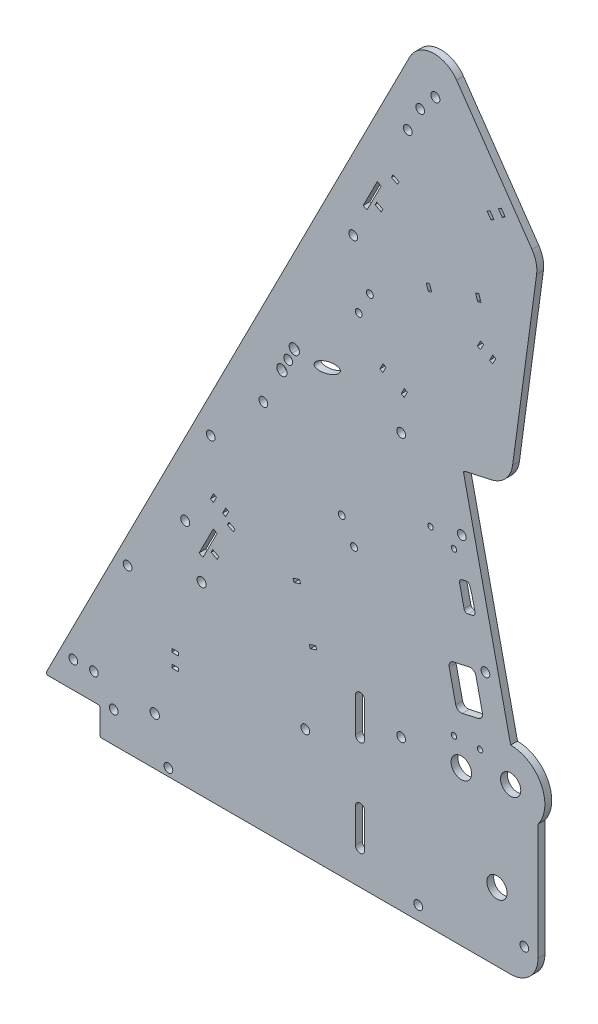
from build123d import *

# Parameters (mm, degrees)
BOSS_EXTRUDE1_DEPTH     = 3.175
SKETCH2_R               = 2.0955
SKETCH2_R_2             = 2.032
SKETCH2_R_3             = 4.699
CUT_EXTRUDE1_DEPTH      = 421.976111717
SKETCH7_R               = 2.159
CUT_EXTRUDE2_DEPTH      = 421.976111717
CUT_EXTRUDE3_REACH      = 422.976
SKETCH10_R              = 2.032
FILLET1_R               = 12.7
FILLET2_R               = 0.79375
SKETCH12_R              = 2.032
CUT_EXTRUDE5_DEPTH      = 411.989226146
CUT_EXTRUDE6_DEPTH      = 411.989226146
CUT_EXTRUDE6_DEPTH_BACK = 411.989226146
SKETCH13_R              = 1.27
SKETCH14_R              = 2.032
SKETCH14_R_2            = 1.6
SKETCH14_RX             = 6.35
SKETCH14_RY             = 2.38125
SKETCH14_W              = 3.175
SKETCH14_H              = 1.5875
CUT_EXTRUDE7_DEPTH      = 411.989226146
SKETCH15_R              = 2.032
CUT_EXTRUDE8_DEPTH      = 411.989226285
FILLET3_R               = 2.54
SKETCH16_R              = 4.7625
CUT_EXTRUDE9_DEPTH      = 411.989226285


with BuildPart() as part:
    # Sketch1 → Boss-Extrude1 (new body)
    with BuildSketch(Plane.XY):
        with BuildLine():
            Line((228.6, -12.7), (228.6, 53.975))
            ThreePointArc((228.6, 53.975), (230.099031657, 70.599515829), (215.9, 79.375))
            Line((215.9, 79.375), (193.909735224, 178.566674323))
            Line((193.909735224, 178.566674323), (215.607913982, 183.377044743))
            Line((215.607913982, 183.377044743), (228.6, 279.4))
            Line((228.6, 279.4), (178.754725958, 351.413083686))
            Line((178.754725958, 351.413083686), (0, 0))
            Line((0, 0), (25.4, 0))
            Line((25.4, 0), (25.4, -12.7))
            Line((25.4, -12.7), (228.6, -12.7))
        make_face()
    extrude(amount=BOSS_EXTRUDE1_DEPTH)

    # Sketch2 → Cut-Extrude1 (cut, through all)
    with BuildSketch(Plane.XY.offset(3.175)):
        with Locations((64.943150167, 94.057839899)):
            Circle(SKETCH2_R)
        with Locations((180.975, 322.164313376)):
            Circle(SKETCH2_R)
        with Locations((72.544547852, 73.173171402)):
            Circle(SKETCH2_R)
        with Locations((193.207821773, 152.394364194)):
            Circle(SKETCH2_R_2)
        with Locations((215.9, 63.5)):
            Circle(SKETCH2_R_3)
        with Locations((173.0375, -6.35)):
            Circle(SKETCH2_R_2)
        with Locations((204.202954161, 102.798527032)):
            Circle(SKETCH2_R_2)
        with Locations((209.55, 19.05)):
            Circle(SKETCH2_R_3)
        with Locations((165.1, 179.3875)):
            Circle(SKETCH2_R_2)
    extrude(amount=-CUT_EXTRUDE1_DEPTH, mode=Mode.SUBTRACT)

    # Sketch7 → Cut-Extrude2 (cut, through all)
    with BuildSketch(Plane.XY.offset(3.175)):
        with Locations((50.8, 9.525)):
            Circle(SKETCH7_R)
        with BuildLine():
            Line((143.891, 3.175), (143.891, 19.05))
            ThreePointArc((143.891, 19.05), (146.05, 21.209), (148.209, 19.05))
            Line((148.209, 19.05), (148.209, 3.175))
            ThreePointArc((148.209, 3.175), (146.05, 1.016), (143.891, 3.175))
        make_face()
        with BuildLine():
            Line((143.891, 47.625), (143.891, 63.5))
            ThreePointArc((143.891, 63.5), (146.05, 65.659), (148.209, 63.5))
            Line((148.209, 63.5), (148.209, 47.625))
            ThreePointArc((148.209, 47.625), (146.05, 45.466), (143.891, 47.625))
        make_face()
    extrude(amount=-CUT_EXTRUDE2_DEPTH, mode=Mode.SUBTRACT)

    # Sketch10 → Cut-Extrude3 (cut, up to next)
    with BuildSketch(Plane.XY.offset(3.175), mode=Mode.PRIVATE) as cut_extrude3_sk1:
        with Locations((165.1, 57.15)):
            Circle(SKETCH10_R)
    cut_extrude3_tool1 = extrude(cut_extrude3_sk1.sketch, amount=-CUT_EXTRUDE3_REACH, mode=Mode.PRIVATE) & part.part
    # Sketch10 → Cut-Extrude3 (cut, up to next)
    with BuildSketch(Plane.XY.offset(3.175), mode=Mode.PRIVATE) as cut_extrude3_sk2:
        with Locations((120.65, 38.1)):
            Circle(SKETCH10_R)
    cut_extrude3_tool2 = extrude(cut_extrude3_sk2.sketch, amount=-CUT_EXTRUDE3_REACH, mode=Mode.PRIVATE) & part.part
    # Sketch10 → Cut-Extrude3 (cut, up to next)
    with BuildSketch(Plane.XY.offset(3.175), mode=Mode.PRIVATE) as cut_extrude3_sk3:
        with Locations((13.046467246, 12.334704411)):
            Circle(SKETCH10_R)
    cut_extrude3_tool3 = extrude(cut_extrude3_sk3.sketch, amount=-CUT_EXTRUDE3_REACH, mode=Mode.PRIVATE) & part.part
    # Sketch10 → Cut-Extrude3 (cut, up to next)
    with BuildSketch(Plane.XY.offset(3.175), mode=Mode.PRIVATE) as cut_extrude3_sk4:
        with Locations((22.571467246, 12.334704411)):
            Circle(SKETCH10_R)
    cut_extrude3_tool4 = extrude(cut_extrude3_sk4.sketch, amount=-CUT_EXTRUDE3_REACH, mode=Mode.PRIVATE) & part.part
    # Sketch10 → Cut-Extrude3 (cut, up to next)
    with BuildSketch(Plane.XY.offset(3.175), mode=Mode.PRIVATE) as cut_extrude3_sk5:
        with Locations((38.211447917, 62.639810909)):
            Circle(SKETCH10_R)
    cut_extrude3_tool5 = extrude(cut_extrude3_sk5.sketch, amount=-CUT_EXTRUDE3_REACH, mode=Mode.PRIVATE) & part.part
    add(cut_extrude3_tool1.solids().sort_by_distance((165.1, 57.15, 3.175))[0], mode=Mode.SUBTRACT)
    add(cut_extrude3_tool2.solids().sort_by_distance((120.65, 38.1, 3.175))[0], mode=Mode.SUBTRACT)
    add(cut_extrude3_tool3.solids().sort_by_distance((13.046467, 12.334704, 3.175))[0], mode=Mode.SUBTRACT)
    add(cut_extrude3_tool4.solids().sort_by_distance((22.571467, 12.334704, 3.175))[0], mode=Mode.SUBTRACT)
    add(cut_extrude3_tool5.solids().sort_by_distance((38.211448, 62.639811, 3.175))[0], mode=Mode.SUBTRACT)

    # Fillet1
    fillet1_edges = [part.edges().sort_by_distance(p)[0] for p in [
        (228.6, -12.7, 1.5875),
        (178.754725958, 351.413083686, 1.5875),
        (215.607913982, 183.377044743, 1.5875),
        (228.6, 279.4, 1.5875),
    ]]
    fillet(fillet1_edges, radius=FILLET1_R)

    # Fillet2
    fillet2_edges = [part.edges().sort_by_distance(p)[0] for p in [
        (25.4, -12.7, 1.5875),
        (25.4, 0, 1.5875),
        (193.909735224, 178.566674323, 1.5875),
        (0, 0, 1.5875),
    ]]
    fillet(fillet2_edges, radius=FILLET2_R)

    # Sketch12 → Cut-Extrude5 (cut, through all)
    with BuildSketch(Plane.XY.offset(3.175)):
        with Locations((31.75, 1.5875)):
            Circle(SKETCH12_R)
        with Locations((222.25, 1.5875)):
            Circle(SKETCH12_R)
        with Locations((57.15, -9.2075)):
            Circle(SKETCH12_R)
    extrude(amount=-CUT_EXTRUDE5_DEPTH, mode=Mode.SUBTRACT)

    # Sketch13 → Cut-Extrude6 (cut, two sides: drawn at the far end of the back side and taken through both)
    with BuildSketch(Plane.XY.offset(3.175).offset(-CUT_EXTRUDE6_DEPTH_BACK)):
        with Locations((189.602197334, 69.980636704)):
            Circle(SKETCH13_R)
        with Locations((201.708862449, 70.509225118)):
            Circle(SKETCH13_R)
        with Locations((178.721644858, 148.532438598)):
            Circle(SKETCH13_R)
        with Locations((189.622629605, 145.09537131)):
            Circle(SKETCH13_R)
        Polygon((186.844411154, 98.950230697), (199.243370445, 101.699013794), (203.36654509, 83.100574858), (190.9675858, 80.351791761), align=None)
        with BuildLine():
            Line((195.12807169, 134.933592333), (193.415301921, 134.553880417))
            ThreePointArc((193.415301921, 134.553880417), (192.420015888, 133.856973634), (192.209029897, 132.660412618))
            Line((192.209029897, 132.660412618), (194.270617219, 123.361193151))
            ThreePointArc((194.270617219, 123.361193151), (194.967524002, 122.365907117), (196.164085018, 122.154921126))
            Line((196.164085018, 122.154921126), (198.109091879, 122.586118766))
            ThreePointArc((198.109091879, 122.586118766), (199.082720469, 123.249946547), (199.330550026, 124.401988414))
            ThreePointArc((199.330550026, 124.401988414), (198.332361402, 129.18494451), (196.979617949, 133.879956193))
            ThreePointArc((196.979617949, 133.879956193), (196.256822614, 134.763465498), (195.12807169, 134.933592333))
        make_face()
    extrude(amount=CUT_EXTRUDE6_DEPTH + CUT_EXTRUDE6_DEPTH_BACK, mode=Mode.SUBTRACT)

    # Sketch14 → Cut-Extrude7 (cut, through all)
    with BuildSketch(Plane.XY.offset(3.175)):
        with Locations((142.875, 247.65)):
            Circle(SKETCH14_R)
        with Locations((112.7125, 182.5625)):
            Circle(SKETCH14_R)
        with Locations((101.196445848, 159.923142748)):
            Circle(SKETCH14_R)
        with Locations((150.594024053, 227.898538502)):
            Circle(SKETCH14_R_2)
        with Locations((145.425401324, 217.737567137)):
            Circle(SKETCH14_R_2)
        with Locations((137.559157345, 132.520985327)):
            Circle(SKETCH14_R_2)
        with Locations((143.259157345, 122.648295723)):
            Circle(SKETCH14_R_2)
        with Locations(Location((130.826142263, 188.461522288), (0, 0, -161.961260538))):
            Ellipse(SKETCH14_RX, SKETCH14_RY)
        Polygon((147.482742003, 261.9243054), (154.04689287, 274.828739034), (155.829519425, 273.921963116), (149.265368558, 261.017529483), align=None)
        Polygon((160.590482388, 279.78010172), (161.310235773, 281.195061549), (164.140155429, 279.75555478), (163.420402045, 278.340594951), align=None)
        Polygon((153.789663007, 266.410402556), (156.619582664, 264.970895787), (155.899829279, 263.555935959), (153.069909623, 264.995442728), align=None)
        Polygon((178.26972852, 245.992253978), (179.240391581, 242.969268992), (177.728899089, 242.483937462), (176.758236028, 245.506922447), align=None)
        Polygon((200.609634347, 249.830809719), (199.638971286, 252.853794704), (201.150463779, 253.339126235), (202.12112684, 250.316141249), align=None)
        Polygon((77.953373051, 97.225512031), (79.735999607, 96.318736114), (73.17184874, 83.41430248), (71.389222185, 84.321078398), align=None)
        Polygon((85.216715955, 103.591834546), (84.49696257, 102.176874718), (87.326882227, 100.737367949), (88.046635611, 102.152327777), align=None)
        Polygon((156.643043941, 199.39992488), (158.08255071, 202.229844536), (156.667590882, 202.949597921), (155.228084113, 200.119678264), align=None)
        Polygon((165.132802911, 195.081404573), (166.57230968, 197.911324229), (167.987269508, 197.191570845), (166.547762739, 194.361651188), align=None)
        Polygon((77.696143189, 88.807175554), (76.976389805, 87.392215725), (79.806309461, 85.952708956), (80.526062846, 87.367668785), align=None)
        Polygon((201.915382504, 234.74968075), (200.475875735, 231.919761094), (201.890835563, 231.200007709), (203.330342332, 234.029927366), align=None)
        Polygon((206.135715047, 229.040747556), (207.575221816, 231.870667212), (208.990181645, 231.150913828), (207.550674876, 228.320994171), align=None)
        Polygon((205.013971437, 288.371538288), (206.820969573, 285.760909487), (208.126283974, 286.664408555), (206.319285837, 289.275037356), align=None)
        Polygon((210.235229039, 291.98553456), (212.042227175, 289.374905759), (213.347541575, 290.278404827), (211.540543439, 292.889033628), align=None)
        Polygon((122.453385221, 73.10367975), (122.951215646, 71.596257739), (125.966059667, 72.591918589), (125.468229242, 74.099340599), align=None)
        Polygon((114.917306673, 95.922796693), (115.415137097, 94.415374682), (118.429981119, 95.411035531), (117.932150694, 96.918457542), align=None)
        with Locations((60.325, 38.89375)):
            Rectangle(SKETCH14_W, SKETCH14_H)
        with Locations((60.325, 32.54375)):
            Rectangle(SKETCH14_W, SKETCH14_H)
        Polygon((78.051560814, 111.424204195), (76.612054045, 108.594284538), (78.027013874, 107.874531154), (79.466520643, 110.70445081), align=None)
        Polygon((82.271893358, 105.715271), (83.711400127, 108.545190657), (85.126359956, 107.825437272), (83.686853187, 104.995517616), align=None)
        with BuildLine():
            add(Edge.make_bspline(
                [(108.753856385, 174.780220945), (110.821723963, 173.728350313), (111.90135404, 175.850790056), (112.980984117, 177.973229798), (110.913116539, 179.025100429)],
                knots=[0, 0, 0, 1.570796327, 1.570796327, 3.141592654, 3.141592654, 3.141592654], degree=2, weights=[1, 0.707106781, 1, 0.707106781, 1]))
            add(Edge.make_bspline(
                [(110.913116539, 179.025100429), (110.77268373, 179.096534959), (110.626511301, 179.154391231), (110.322493118, 179.242488117), (110.165373026, 179.272144601), (109.695542578, 179.315227584), (109.373415846, 179.283109915), (108.9218002, 179.145618276), (108.77365547, 179.084104344), (108.495402792, 178.934315945), (108.365007933, 178.846412483), (108.121928357, 178.644218756), (108.0096946, 178.529696631), (107.813416216, 178.283892413), (107.727754596, 178.151249117), (107.58342172, 177.86715543), (107.526957985, 177.720181494), (107.444132542, 177.416788403), (107.417775942, 177.25846019), (107.397765558, 176.943245973), (107.403605499, 176.786285249), (107.446503964, 176.473637327), (107.48413539, 176.317513381), (107.58741463, 176.020451076), (107.653173274, 175.877669132), (107.813265642, 175.6037409), (107.906595752, 175.474826714), (108.217757093, 175.120973916), (108.473611136, 174.922774438), (108.753856385, 174.780220945)],
                knots=[0, 0, 0, 0, 0.0625, 0.0625, 0.125, 0.125, 0.25, 0.25, 0.3125, 0.3125, 0.375, 0.375, 0.4375, 0.4375, 0.5, 0.5, 0.5625, 0.5625, 0.625, 0.625, 0.6875, 0.6875, 0.75, 0.75, 0.8125, 0.8125, 0.875, 0.875, 1, 1, 1, 1], degree=3))
        make_face()
        with BuildLine():
            add(Edge.make_bspline(
                [(114.511883461, 186.099899571), (116.579751039, 185.048028939), (117.659381116, 187.170468682), (118.739011193, 189.292908424), (116.671143615, 190.344779055)],
                knots=[0, 0, 0, 1.570796327, 1.570796327, 3.141592654, 3.141592654, 3.141592654], degree=2, weights=[1, 0.707106781, 1, 0.707106781, 1]))
            add(Edge.make_bspline(
                [(114.511883461, 186.099899571), (114.371072576, 186.171526418), (114.235866303, 186.257351722), (113.987547839, 186.450065421), (113.872855617, 186.557654504), (113.558328181, 186.915480737), (113.397407635, 187.190062471), (113.24126374, 187.640077887), (113.204646123, 187.792957095), (113.161785412, 188.104373095), (113.155794463, 188.264784445), (113.176022459, 188.579744294), (113.201753482, 188.734678369), (113.28477823, 189.039401247), (113.342554455, 189.189068059), (113.556262174, 189.609540487), (113.758638915, 189.862727621), (114.121215939, 190.164706401), (114.254157477, 190.254446578), (114.53236698, 190.404090785), (114.677524715, 190.464472802), (114.97978581, 190.556739169), (115.136913319, 190.588175808), (115.449881014, 190.619878989), (115.607376248, 190.620744977), (115.924438129, 190.591785045), (116.079517328, 190.562319108), (116.3815103, 190.475083726), (116.53003913, 190.416555249), (116.671143615, 190.344779055)],
                knots=[0, 0, 0, 0, 0.0625, 0.0625, 0.125, 0.125, 0.25, 0.25, 0.3125, 0.3125, 0.375, 0.375, 0.4375, 0.4375, 0.5, 0.5, 0.625, 0.625, 0.6875, 0.6875, 0.75, 0.75, 0.8125, 0.8125, 0.875, 0.875, 0.9375, 0.9375, 1, 1, 1, 1], degree=3))
        make_face()
    extrude(amount=-CUT_EXTRUDE7_DEPTH, mode=Mode.SUBTRACT)

    # Sketch15 → Cut-Extrude8 (cut, through all)
    with BuildSketch(Plane.XY.offset(3.175)):
        with Locations((76.786819993, 134.148053636)):
            Circle(SKETCH15_R)
        with Locations((173.947223848, 313.950707072)):
            Circle(SKETCH15_R)
        with Locations((168.189196772, 302.631028446)):
            Circle(SKETCH15_R)
    extrude(amount=-CUT_EXTRUDE8_DEPTH, mode=Mode.SUBTRACT)

    # Fillet3
    fillet3_edges = [part.edges().sort_by_distance(p)[0] for p in [
        (199.243370445, 101.699013794, 1.5875),
        (186.844411154, 98.950230697, 1.5875),
        (190.9675858, 80.351791761, 1.5875),
        (203.36654509, 83.100574858, 1.5875),
    ]]
    fillet(fillet3_edges, radius=FILLET3_R)

    # Sketch16 → Cut-Extrude9 (cut, through all)
    with BuildSketch(Plane.XY.offset(3.175)):
        with Locations((193.04, 58.801)):
            Circle(SKETCH16_R)
    extrude(amount=-CUT_EXTRUDE9_DEPTH, mode=Mode.SUBTRACT)


solid = part.part
